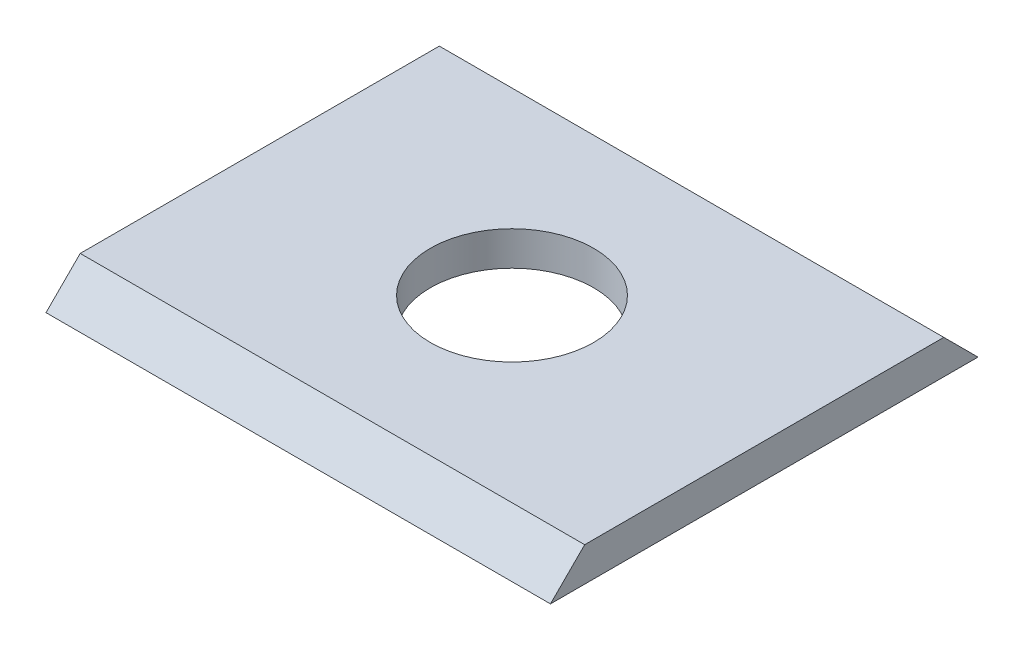
from build123d import *

# Parameters (mm, degrees)
SKETCH1_W           = 59
SKETCH1_H           = 50
SKETCH1_R           = 9.55
BOSS_EXTRUDE1_DEPTH = 4
CHAMFER1_SIZE       = 4


with BuildPart() as part:
    # Sketch1 → Boss-Extrude1 (new body)
    with BuildSketch(Plane(origin=(0, 0, 0), x_dir=(1, 0, 0), z_dir=(0, 1, 0))):
        with Locations((29.5, 25)):
            Rectangle(SKETCH1_W, SKETCH1_H)
        with Locations(Location((29.5, 25, 0), (0, 0, 270))):
            Circle(SKETCH1_R, mode=Mode.SUBTRACT)
    extrude(amount=BOSS_EXTRUDE1_DEPTH)

    # Chamfer1
    chamfer1_edges = [part.edges().sort_by_distance(p)[0] for p in [
        (29.5, 4, -50),
        (29.5, 4, 0),
    ]]
    chamfer(chamfer1_edges, length=CHAMFER1_SIZE - 0.0001)  # a hair under: the kernel refuses the full size


solid = part.part
